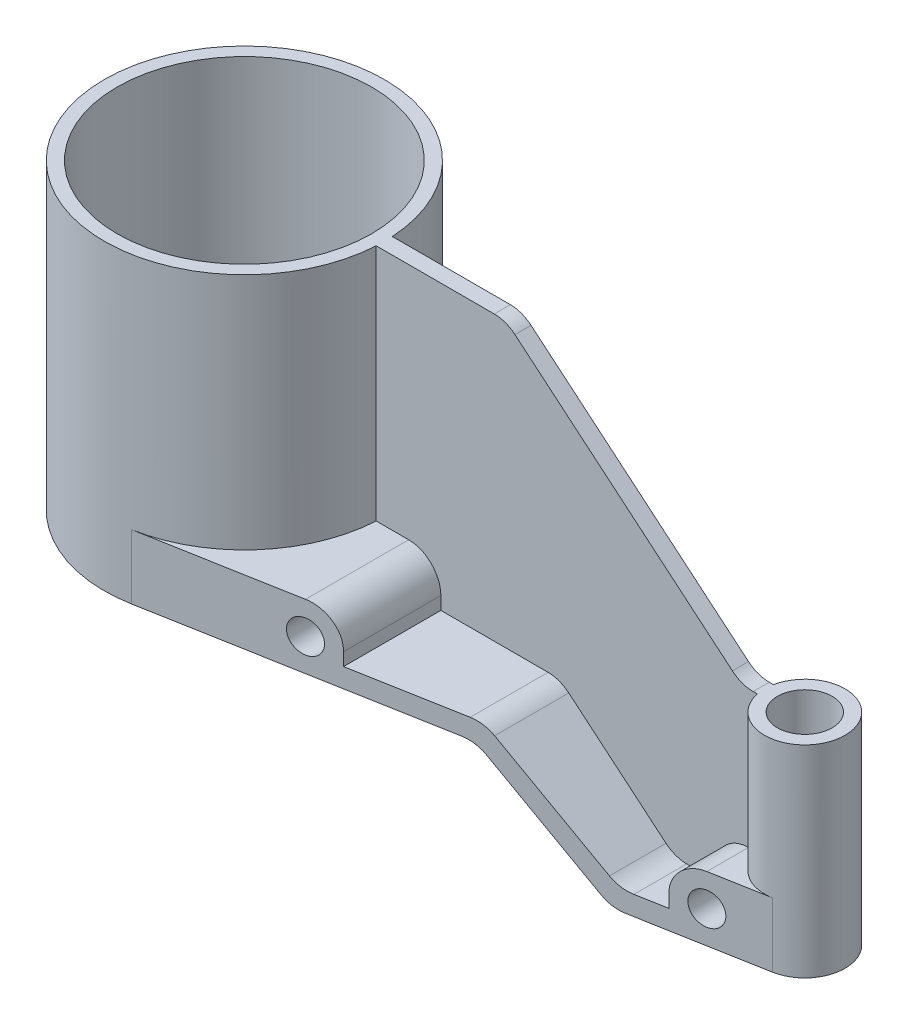
from build123d import *

# Parameters (mm, degrees)
SKETCH2_R                = 43.5
BOSS_EXTRUDE1_DEPTH      = 94
BOSS_EXTRUDE2_START      = -30
SKETCH2_3_R              = 12.5
BOSS_EXTRUDE2_DEPTH      = 62.666667
EXTRUDE_THIN1_DEPTH      = 115
BOSS_EXTRUDE3_START      = -230
SKETCH5_W                = 100
SKETCH5_H                = 20
SKETCH5_W_2              = 50
BOSS_EXTRUDE3_DEPTH      = 230
CUT_EXTRUDE2_DEPTH       = 319.334729
CUT_EXTRUDE2_DEPTH_BACK  = 319.334729
SKETCH5_3_R              = 5
CUT_EXTRUDE1_START       = -30
CUT_EXTRUDE1_OUTLINE_R   = 8.5
CUT_EXTRUDE1_OUTLINE_R_2 = 39.5
CUT_EXTRUDE1_DEPTH       = 124
RIB1_START               = -2.5
RIB1_DEPTH               = 5
FILLET1_R                = 10


# Read off the part's stored shape, not the designer's step: Cut-Extrude1, Rib1
with BuildPart() as part:
    # Sketch2 → Boss-Extrude1 (new body)
    with BuildSketch(Plane(origin=(0, 0, 0), x_dir=(1, 0, 0), z_dir=(0, 1, 0))):
        with Locations(Location((0, 0, 0), (0, 0, 270))):
            Circle(SKETCH2_R)
    extrude(amount=BOSS_EXTRUDE1_DEPTH)



with BuildPart() as body_2:
    # Sketch2<3> → Boss-Extrude2 (new body)
    with BuildSketch(Plane(origin=(0, 0, 0), x_dir=(1, 0, 0), z_dir=(0, 1, 0)).offset(BOSS_EXTRUDE2_START)):
        with Locations(Location((174, 0, 0), (0, 0, 270))):
            Circle(SKETCH2_3_R)
    extrude(amount=BOSS_EXTRUDE2_DEPTH)


with BuildPart() as part_1:
    add(part.part)

    add(body_2.part)  # Extrude-Thin1 merges body 2
    # Sketch3 → Extrude-Thin1 (add, symmetric)
    with BuildSketch(Plane.XY):
        Polygon((-43.5, 0), (98.247392, 0), (134, -30), (186.5, -30), (186.5, -24), (136.183821, -24), (100.431214, 6), (-43.5, 6), align=None)
    extrude(amount=EXTRUDE_THIN1_DEPTH, both=True)

    # Sketch5 → Boss-Extrude3 (add)
    with BuildSketch(Plane.XY.offset(115).offset(BOSS_EXTRUDE3_START)):
        with Locations((13.5, 10)):
            Rectangle(SKETCH5_W, SKETCH5_H)
        with Locations((174, -20)):
            Rectangle(SKETCH5_W_2, SKETCH5_H)
    extrude(amount=BOSS_EXTRUDE3_DEPTH)

    # Sketch5<3> → Cut-Extrude2 (cut, two sides: drawn at the far end of the back side and taken through both)
    with BuildSketch(Plane.XY.offset(115).offset(-CUT_EXTRUDE2_DEPTH_BACK)):
        with Locations((53.5, 10)):
            Circle(SKETCH5_3_R)
        with Locations((159, -20)):
            Circle(SKETCH5_3_R)
    extrude(amount=CUT_EXTRUDE2_DEPTH + CUT_EXTRUDE2_DEPTH_BACK, mode=Mode.SUBTRACT)

    # Cut-Extrude1 outline → Cut-Extrude1 (cut)
    with BuildSketch(Plane(origin=(0, 0, 0), x_dir=(1, 0, 0), z_dir=(0, 1, 0)).offset(CUT_EXTRUDE1_START)):
        with Locations((174, 0)):
            Circle(CUT_EXTRUDE1_OUTLINE_R)
        with BuildLine():
            ThreePointArc((-36.5, 23.664319), (-17.269135, 39.925267), (7.75, 42.804059))
            Line((7.75, 42.804059), (63.5, 32.710099))
            Line((63.5, 32.710099), (63.5, 115))
            Line((63.5, 115), (-36.5, 115))
            Line((-36.5, 115), (-36.5, 23.664319))
        make_face()
        with BuildLine():
            Line((63.5, -32.710099), (7.75, -42.804059))
            ThreePointArc((7.75, -42.804059), (-17.269135, -39.925267), (-36.5, -23.664319))
            Line((-36.5, -23.664319), (-36.5, -115))
            Line((-36.5, -115), (63.5, -115))
            Line((63.5, -115), (63.5, -32.710099))
        make_face()
        with BuildLine():
            ThreePointArc((-43.5, 0), (-41.713307, 12.338963), (-36.5, 23.664319))
            Line((-36.5, 23.664319), (-36.5, 115))
            Line((-36.5, 115), (-43.5, 115))
            Line((-43.5, 115), (-43.5, 0))
        make_face()
        Polygon((63.5, 115), (63.5, 32.710099), (149, 17.229674), (149, 115), align=None)
        with BuildLine():
            Line((-36.5, -115), (-36.5, -23.664319))
            ThreePointArc((-36.5, -23.664319), (-41.713307, -12.338963), (-43.5, 0))
            Line((-43.5, 0), (-43.5, -115))
            Line((-43.5, -115), (-36.5, -115))
        make_face()
        Polygon((149, -17.229674), (63.5, -32.710099), (63.5, -115), (149, -115), align=None)
        with BuildLine():
            Line((149, 115), (149, 17.229674))
            Line((149, 17.229674), (176.227011, 12.300017))
            ThreePointArc((176.227011, 12.300017), (183.593947, 8.012876), (186.5, 0))
            ThreePointArc((186.5, 0), (183.593947, -8.012876), (176.227011, -12.300017))
            Line((176.227011, -12.300017), (149, -17.229674))
            Line((149, -17.229674), (149, -115))
            Line((149, -115), (199, -115))
            Line((199, -115), (199, 115))
            Line((199, 115), (149, 115))
        make_face()
        Circle(CUT_EXTRUDE1_OUTLINE_R_2)
    extrude(amount=CUT_EXTRUDE1_DEPTH, mode=Mode.SUBTRACT)

    # Rib1 outline → Rib1 (add)
    with BuildSketch(Plane.XY.offset(RIB1_START)):
        Polygon((156.808801, 32.666667), (83.714581, 94), (42, 94), (42, 20), (63.5, 20), (63.5, 6), (100.431214, 6), (136.183821, -24), (149, -24), (149, -10), (163, -10), (163, 32.666667), align=None)
    extrude(amount=RIB1_DEPTH)

    # Fillet1
    # the kernel refuses this fillet: 10 mm, written as the material it adds along each edge
    with BuildSketch(Plane(origin=(98.247392, 0, -35.518075), x_dir=(-1, 0, 0), z_dir=(0, 0, 1))) as fillet1_piece_1_section:
        with BuildLine():
            CenterArc((FILLET1_R * 0.363970234266, FILLET1_R), FILLET1_R, 230, 40)
            Line((-FILLET1_R * 0.27881737542, FILLET1_R * 0.233955556881), (0, 0))
            Line((0, 0), (FILLET1_R * 0.363970234266, 0))
        make_face()
    fillet1_piece_1 = extrude(amount=71.03615, mode=Mode.PRIVATE)
    fillet1_piece_1 = split(fillet1_piece_1, bisect_by=Plane(origin=(102.693133, -0.478631, -25.613884), z_dir=(-0.17816091954075147, 0, 0.9840013652167328)), keep=Keep.TOP, mode=Mode.PRIVATE)
    fillet1_piece_1 = split(fillet1_piece_1, bisect_by=Plane(origin=(102.693133, -0.478631, 25.613884), z_dir=(-0.17816091954075147, 0, -0.9840013652167328)), keep=Keep.TOP, mode=Mode.PRIVATE)
    add(fillet1_piece_1)
    with BuildSketch(Plane(origin=(136.183821, -24, -6.599256), x_dir=(-0.7660444431189806, 0.6427876096865363, 0), z_dir=(0, 0, 1))) as fillet1_piece_2_section:
        with BuildLine():
            CenterArc((FILLET1_R * 0.363970234266, -FILLET1_R), FILLET1_R, 90, 40)
            Line((-FILLET1_R * 0.27881737542, -FILLET1_R * 0.233955556881), (0, 0))
            Line((0, 0), (FILLET1_R * 0.363970234266, 0))
        make_face()
    fillet1_piece_2 = extrude(amount=35.248652, mode=Mode.PRIVATE)
    fillet1_piece_2 = split(fillet1_piece_2, bisect_by=Plane(origin=(140.141098, -23.515892, 18.833646), z_dir=(-0.17816091954075147, 0, -0.9840013652167328)), keep=Keep.TOP, mode=Mode.PRIVATE)
    add(fillet1_piece_2)
    with BuildSketch(Plane(origin=(136.183821, -24, -28.649397), x_dir=(1, 0, 0), z_dir=(0, 0, 1))) as fillet1_piece_3_section:
        with BuildLine():
            CenterArc((FILLET1_R * 0.363970234266, FILLET1_R), FILLET1_R, 230, 40)
            Line((-FILLET1_R * 0.27881737542, FILLET1_R * 0.233955556881), (0, 0))
            Line((0, 0), (FILLET1_R * 0.363970234266, 0))
        make_face()
    fillet1_piece_3 = extrude(amount=35.248652, mode=Mode.PRIVATE)
    fillet1_piece_3 = split(fillet1_piece_3, bisect_by=Plane(origin=(137.827829, -23.50738, -19.252481), z_dir=(-0.17816091954075147, 0, 0.9840013652167328)), keep=Keep.TOP, mode=Mode.PRIVATE)
    add(fillet1_piece_3)
    with BuildSketch(Plane(origin=(156.808801, 32.666667, -2.5), x_dir=(1, 0, 0), z_dir=(0, 0, 1))) as fillet1_piece_4:
        with BuildLine():
            CenterArc((FILLET1_R * 0.363970234268, FILLET1_R), FILLET1_R, 230, 40)
            Line((-FILLET1_R * 0.278817375421, FILLET1_R * 0.233955556883), (0, 0))
            Line((0, 0), (FILLET1_R * 0.363970234268, 0))
        make_face()
    extrude(amount=5)
    # the kernel refuses this fillet: 10 mm, written as the material it takes off along each edge
    with BuildSketch(Plane(origin=(100.431214, 6, 35.122678), x_dir=(-1, 0, 0), z_dir=(0, 0, -1))) as fillet1_2_piece_1:
        with BuildLine():
            CenterArc((FILLET1_R * 0.363970234266, -FILLET1_R), FILLET1_R, 90, 40)
            Line((-FILLET1_R * 0.27881737542, -FILLET1_R * 0.233955556881), (0, 0))
            Line((0, 0), (FILLET1_R * 0.363970234266, 0))
        make_face()
    extrude(amount=32.622678, mode=Mode.SUBTRACT)
    with BuildSketch(Plane(origin=(100.431214, 6, 35.122678), x_dir=(-1, 0, 0), z_dir=(0, 0, -1))) as fillet1_2_piece_2_section:
        with BuildLine():
            CenterArc((FILLET1_R * 0.363970234266, -FILLET1_R), FILLET1_R, 90, 40)
            Line((-FILLET1_R * 0.27881737542, -FILLET1_R * 0.233955556881), (0, 0))
            Line((0, 0), (FILLET1_R * 0.363970234266, 0))
        make_face()
    fillet1_2_piece_2 = extrude(amount=41.721934, mode=Mode.PRIVATE)
    fillet1_2_piece_2 = split(fillet1_2_piece_2, bisect_by=Plane(origin=(100.255013, 5.515892, -2.5), z_dir=(0, 0, -1)), keep=Keep.TOP, mode=Mode.PRIVATE)
    add(fillet1_2_piece_2, mode=Mode.SUBTRACT)
    with BuildSketch(Plane(origin=(134, -30, -29.044794), x_dir=(-0.766044443118982, 0.6427876096865346, 0), z_dir=(0, 0, 1))) as fillet1_2_piece_3:
        with BuildLine():
            CenterArc((FILLET1_R * 0.363970234266, -FILLET1_R), FILLET1_R, 90, 40)
            Line((-FILLET1_R * 0.27881737542, -FILLET1_R * 0.233955556881), (0, 0))
            Line((0, 0), (FILLET1_R * 0.363970234266, 0))
        make_face()
    extrude(amount=58.089588, mode=Mode.SUBTRACT)
    with BuildSketch(Plane(origin=(149, -10, -22.5), x_dir=(0, -1, 0), z_dir=(0, 0, 1))) as fillet1_2_piece_4_section:
        with BuildLine():
            CenterArc((FILLET1_R, FILLET1_R), FILLET1_R, 180, 90)
            Line((0, FILLET1_R), (0, 0))
            Line((0, 0), (FILLET1_R, 0))
        make_face()
    fillet1_2_piece_4 = extrude(amount=64.729674, mode=Mode.PRIVATE)
    fillet1_2_piece_4 = split(fillet1_2_piece_4, bisect_by=Plane(origin=(151.263951, -12.263951, -2.5), z_dir=(0, 0, -1)), keep=Keep.TOP, mode=Mode.PRIVATE)
    add(fillet1_2_piece_4, mode=Mode.SUBTRACT)
    with BuildSketch(Plane(origin=(149, -10, 2.5), x_dir=(0, -1, 0), z_dir=(0, 0, 1))) as fillet1_2_piece_5:
        with BuildLine():
            CenterArc((FILLET1_R, FILLET1_R), FILLET1_R, 180, 90)
            Line((0, FILLET1_R), (0, 0))
            Line((0, 0), (FILLET1_R, 0))
        make_face()
    extrude(amount=39.729674, mode=Mode.SUBTRACT)
    with BuildSketch(Plane(origin=(100.431214, 6, 6.599256), x_dir=(0.7660444431189812, -0.6427876096865356, 0), z_dir=(0, 0, -1))) as fillet1_2_piece_6_section:
        with BuildLine():
            CenterArc((FILLET1_R * 0.363970234266, FILLET1_R), FILLET1_R, 230, 40)
            Line((-FILLET1_R * 0.27881737542, FILLET1_R * 0.233955556881), (0, 0))
            Line((0, 0), (FILLET1_R * 0.363970234266, 0))
        make_face()
    fillet1_2_piece_6 = extrude(amount=41.721934, mode=Mode.PRIVATE)
    fillet1_2_piece_6 = split(fillet1_2_piece_6, bisect_by=Plane(origin=(100.255013, 5.515892, 2.5), z_dir=(0, 0, 1)), keep=Keep.TOP, mode=Mode.PRIVATE)
    add(fillet1_2_piece_6, mode=Mode.SUBTRACT)
    with BuildSketch(Plane(origin=(100.431214, 6, -2.5), x_dir=(0.7660444431189812, -0.6427876096865356, 0), z_dir=(0, 0, -1))) as fillet1_2_piece_7:
        with BuildLine():
            CenterArc((FILLET1_R * 0.363970234266, FILLET1_R), FILLET1_R, 230, 40)
            Line((-FILLET1_R * 0.27881737542, FILLET1_R * 0.233955556881), (0, 0))
            Line((0, 0), (FILLET1_R * 0.363970234266, 0))
        make_face()
    extrude(amount=32.622678, mode=Mode.SUBTRACT)
    with BuildSketch(Plane(origin=(63.5, 20, -22.5), x_dir=(-1, 0, 0), z_dir=(0, 0, 1))) as fillet1_2_piece_8_section:
        with BuildLine():
            CenterArc((FILLET1_R, FILLET1_R), FILLET1_R, 180, 90)
            Line((0, FILLET1_R), (0, 0))
            Line((0, 0), (FILLET1_R, 0))
        make_face()
    fillet1_2_piece_8 = extrude(amount=80.210099, mode=Mode.PRIVATE)
    fillet1_2_piece_8 = split(fillet1_2_piece_8, bisect_by=Plane(origin=(61.236049, 17.736049, -2.5), z_dir=(0, 0, -1)), keep=Keep.TOP, mode=Mode.PRIVATE)
    add(fillet1_2_piece_8, mode=Mode.SUBTRACT)
    with BuildSketch(Plane(origin=(63.5, 20, 2.5), x_dir=(-1, 0, 0), z_dir=(0, 0, 1))) as fillet1_2_piece_9:
        with BuildLine():
            CenterArc((FILLET1_R, FILLET1_R), FILLET1_R, 180, 90)
            Line((0, FILLET1_R), (0, 0))
            Line((0, 0), (FILLET1_R, 0))
        make_face()
    extrude(amount=55.210099, mode=Mode.SUBTRACT)
    with BuildSketch(Plane(origin=(83.714581, 94, -11.599256), x_dir=(-1, 0, 0), z_dir=(0, 0, 1))) as fillet1_2_piece_10:
        with BuildLine():
            CenterArc((FILLET1_R * 0.363970234268, FILLET1_R), FILLET1_R, 230, 40)
            Line((-FILLET1_R * 0.278817375421, FILLET1_R * 0.233955556883), (0, 0))
            Line((0, 0), (FILLET1_R * 0.363970234268, 0))
        make_face()
    extrude(amount=23.198512, mode=Mode.SUBTRACT)
    with BuildSketch(Plane(origin=(149, -10, -42.229674), x_dir=(1, 0, 0), z_dir=(0, 0, 1))) as fillet1_2_piece_11:
        with BuildLine():
            CenterArc((FILLET1_R, -FILLET1_R), FILLET1_R, 90, 90)
            Line((0, -FILLET1_R), (0, 0))
            Line((0, 0), (FILLET1_R, 0))
        make_face()
    extrude(amount=39.729674, mode=Mode.SUBTRACT)
    with BuildSketch(Plane(origin=(149, -10, -42.229674), x_dir=(1, 0, 0), z_dir=(0, 0, 1))) as fillet1_2_piece_12_section:
        with BuildLine():
            CenterArc((FILLET1_R, -FILLET1_R), FILLET1_R, 90, 90)
            Line((0, -FILLET1_R), (0, 0))
            Line((0, 0), (FILLET1_R, 0))
        make_face()
    fillet1_2_piece_12 = extrude(amount=64.729674, mode=Mode.PRIVATE)
    fillet1_2_piece_12 = split(fillet1_2_piece_12, bisect_by=Plane(origin=(151.263951, -12.263951, 2.5), z_dir=(0, 0, 1)), keep=Keep.TOP, mode=Mode.PRIVATE)
    add(fillet1_2_piece_12, mode=Mode.SUBTRACT)
    with BuildSketch(Plane(origin=(63.5, 20, -57.710099), x_dir=(0, -1, 0), z_dir=(0, 0, 1))) as fillet1_2_piece_13:
        with BuildLine():
            CenterArc((FILLET1_R, -FILLET1_R), FILLET1_R, 90, 90)
            Line((0, -FILLET1_R), (0, 0))
            Line((0, 0), (FILLET1_R, 0))
        make_face()
    extrude(amount=55.210099, mode=Mode.SUBTRACT)
    with BuildSketch(Plane(origin=(63.5, 20, -57.710099), x_dir=(0, -1, 0), z_dir=(0, 0, 1))) as fillet1_2_piece_14_section:
        with BuildLine():
            CenterArc((FILLET1_R, -FILLET1_R), FILLET1_R, 90, 90)
            Line((0, -FILLET1_R), (0, 0))
            Line((0, 0), (FILLET1_R, 0))
        make_face()
    fillet1_2_piece_14 = extrude(amount=80.210099, mode=Mode.PRIVATE)
    fillet1_2_piece_14 = split(fillet1_2_piece_14, bisect_by=Plane(origin=(61.236049, 17.736049, 2.5), z_dir=(0, 0, 1)), keep=Keep.TOP, mode=Mode.PRIVATE)
    add(fillet1_2_piece_14, mode=Mode.SUBTRACT)


solid = part_1.part
